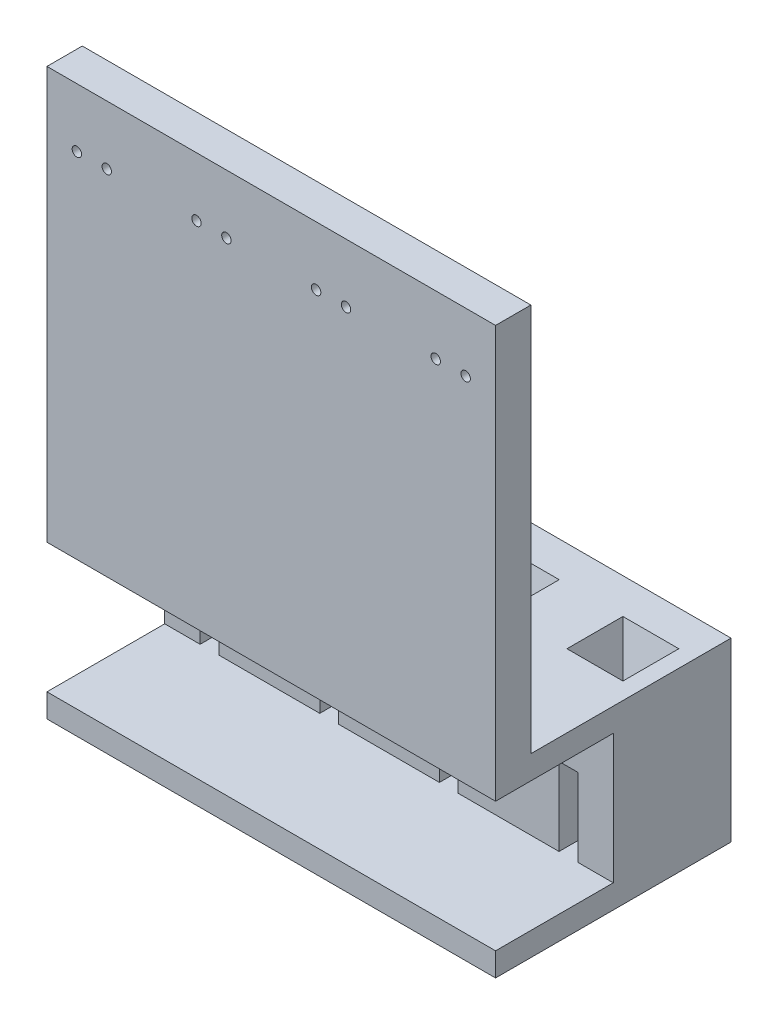
from build123d import *
from OCP.BRepFilletAPI import BRepFilletAPI_MakeChamfer

# Parameters (mm, degrees)
SKETCH_1_W          = 38.1
SKETCH_1_H          = 48
EXTRUDE_1_DEPTH     = 3
SKETCH_2_R          = 0.4
CUT_EXTRUDE_1_DEPTH = 31.78802527
SKETCH_3_W          = 38.1
SKETCH_3_H          = 15
EXTRUDE_2_DEPTH     = 17
SKETCH_4_W          = 2.75
SKETCH_4_H          = 2.75
CUT_EXTRUDE_2_DEPTH = 4
CHAMFER_1_SIZE      = 1
CHAMFER_1_SIZE_2    = 4
SKETCH_5_R          = 0.8
CUT_EXTRUDE_5_DEPTH = 55.36821222
SKETCH_6_W          = 38.1
SKETCH_6_H          = 11
CUT_EXTRUDE_6_DEPTH = 10
CUT_EXTRUDE_7_REACH = 34.232
SKETCH_8_W          = 1.6
SKETCH_8_H          = 6.622641265


with BuildPart() as part:
    # 草圖1 → 填料-伸長1 (new body)
    with BuildSketch(Plane.XY):
        Rectangle(SKETCH_1_W, SKETCH_1_H)
    extrude(amount=EXTRUDE_1_DEPTH)

    # 草圖2 → 除料-伸長1 (cut, through all)
    with BuildSketch(Plane.XY.offset(3)):
        with Locations((-16.51, 19)):
            Circle(SKETCH_2_R)
        with Locations((-13.97, 19)):
            Circle(SKETCH_2_R)
        with Locations((-6.35, 19)):
            Circle(SKETCH_2_R)
        with Locations((-3.81, 19)):
            Circle(SKETCH_2_R)
        with Locations((3.81, 19)):
            Circle(SKETCH_2_R)
        with Locations((6.35, 19)):
            Circle(SKETCH_2_R)
        with Locations((13.97, 19)):
            Circle(SKETCH_2_R)
        with Locations((16.51, 19)):
            Circle(SKETCH_2_R)
    extrude(amount=-CUT_EXTRUDE_1_DEPTH, mode=Mode.SUBTRACT)

    # 草圖3 → 填料-伸長2 (add)
    with BuildSketch(Plane(origin=(0, 0, 0), x_dir=(-1, 0, 0), z_dir=(0, 0, -1))):
        with Locations((0, -16.5)):
            Rectangle(SKETCH_3_W, SKETCH_3_H)
    extrude(amount=EXTRUDE_2_DEPTH)

    # 草圖4 → 除料-伸長2 (cut)
    with BuildSketch(Plane(origin=(0, -9, 0), x_dir=(1, 0, 0), z_dir=(0, 1, 0))):
        with Locations((-15.24, 11.625)):
            Rectangle(SKETCH_4_W, SKETCH_4_H)
        with Locations((-5.08, 11.625)):
            Rectangle(SKETCH_4_W, SKETCH_4_H)
        with Locations((5.08, 11.625)):
            Rectangle(SKETCH_4_W, SKETCH_4_H)
        with Locations((15.24, 11.625)):
            Rectangle(SKETCH_4_W, SKETCH_4_H)
    extrude(amount=-CUT_EXTRUDE_2_DEPTH, mode=Mode.SUBTRACT)

    # 導角1
    chamfer_1_edges_1 = [part.edges().sort_by_distance(p)[0] for p in [
        (-15.24, -9, -13),
    ]]
    chamfer_1_side_1 = [part.faces().sort_by_distance(p)[0] for p in [
        (-15.24, -9, -13.02),
    ]]
    chamfer_1_edges_2 = [part.edges().sort_by_distance(p)[0] for p in [
        (-13.865, -9, -11.625),
    ]]
    chamfer_1_side_2 = [part.faces().sort_by_distance(p)[0] for p in [
        (-13.845, -9, -11.625),
    ]]
    chamfer_1_edges_3 = [part.edges().sort_by_distance(p)[0] for p in [
        (-16.615, -9, -11.625),
    ]]
    chamfer_1_side_3 = [part.faces().sort_by_distance(p)[0] for p in [
        (-16.635, -9, -11.625),
    ]]
    chamfer_1_edges_4 = [part.edges().sort_by_distance(p)[0] for p in [
        (-15.24, -9, -10.25),
    ]]
    chamfer_1_side_4 = [part.faces().sort_by_distance(p)[0] for p in [
        (-15.24, -9, -10.23),
    ]]
    chamfer_1_edges_5 = [part.edges().sort_by_distance(p)[0] for p in [
        (15.24, -9, -10.25),
    ]]
    chamfer_1_side_5 = [part.faces().sort_by_distance(p)[0] for p in [
        (15.24, -9, -10.23),
    ]]
    chamfer_1_edges_6 = [part.edges().sort_by_distance(p)[0] for p in [
        (13.865, -9, -11.625),
    ]]
    chamfer_1_side_6 = [part.faces().sort_by_distance(p)[0] for p in [
        (13.845, -9, -11.625),
    ]]
    chamfer_1_edges_7 = [part.edges().sort_by_distance(p)[0] for p in [
        (16.615, -9, -11.625),
    ]]
    chamfer_1_side_7 = [part.faces().sort_by_distance(p)[0] for p in [
        (16.635, -9, -11.625),
    ]]
    chamfer_1_edges_8 = [part.edges().sort_by_distance(p)[0] for p in [
        (15.24, -9, -13),
    ]]
    chamfer_1_side_8 = [part.faces().sort_by_distance(p)[0] for p in [
        (15.24, -9, -13.02),
    ]]
    chamfer_1_edges_9 = [part.edges().sort_by_distance(p)[0] for p in [
        (5.08, -9, -10.25),
    ]]
    chamfer_1_side_9 = [part.faces().sort_by_distance(p)[0] for p in [
        (5.08, -9, -10.23),
    ]]
    chamfer_1_edges_10 = [part.edges().sort_by_distance(p)[0] for p in [
        (6.455, -9, -11.625),
    ]]
    chamfer_1_side_10 = [part.faces().sort_by_distance(p)[0] for p in [
        (6.475, -9, -11.625),
    ]]
    chamfer_1_edges_11 = [part.edges().sort_by_distance(p)[0] for p in [
        (5.08, -9, -13),
    ]]
    chamfer_1_side_11 = [part.faces().sort_by_distance(p)[0] for p in [
        (5.08, -9, -13.02),
    ]]
    chamfer_1_edges_12 = [part.edges().sort_by_distance(p)[0] for p in [
        (3.705, -9, -11.625),
    ]]
    chamfer_1_side_12 = [part.faces().sort_by_distance(p)[0] for p in [
        (3.685, -9, -11.625),
    ]]
    chamfer_1_edges_13 = [part.edges().sort_by_distance(p)[0] for p in [
        (-5.08, -9, -10.25),
    ]]
    chamfer_1_side_13 = [part.faces().sort_by_distance(p)[0] for p in [
        (-5.08, -9, -10.23),
    ]]
    chamfer_1_edges_14 = [part.edges().sort_by_distance(p)[0] for p in [
        (-6.455, -9, -11.625),
    ]]
    chamfer_1_side_14 = [part.faces().sort_by_distance(p)[0] for p in [
        (-6.475, -9, -11.625),
    ]]
    chamfer_1_edges_15 = [part.edges().sort_by_distance(p)[0] for p in [
        (-5.08, -9, -13),
    ]]
    chamfer_1_side_15 = [part.faces().sort_by_distance(p)[0] for p in [
        (-5.08, -9, -13.02),
    ]]
    chamfer_1_edges_16 = [part.edges().sort_by_distance(p)[0] for p in [
        (-3.705, -9, -11.625),
    ]]
    chamfer_1_side_16 = [part.faces().sort_by_distance(p)[0] for p in [
        (-3.685, -9, -11.625),
    ]]
    chamfer_1 = BRepFilletAPI_MakeChamfer(part.part.solid().wrapped)
    for e in chamfer_1_edges_1:
        chamfer_1.Add(CHAMFER_1_SIZE - 0.0001, CHAMFER_1_SIZE_2 - 0.0001, e.wrapped, chamfer_1_side_1[0].wrapped)
    for e in chamfer_1_edges_2:
        chamfer_1.Add(CHAMFER_1_SIZE - 0.0001, CHAMFER_1_SIZE_2 - 0.0001, e.wrapped, chamfer_1_side_2[0].wrapped)
    for e in chamfer_1_edges_3:
        chamfer_1.Add(CHAMFER_1_SIZE - 0.0001, CHAMFER_1_SIZE_2 - 0.0001, e.wrapped, chamfer_1_side_3[0].wrapped)
    for e in chamfer_1_edges_4:
        chamfer_1.Add(CHAMFER_1_SIZE - 0.0001, CHAMFER_1_SIZE_2 - 0.0001, e.wrapped, chamfer_1_side_4[0].wrapped)
    for e in chamfer_1_edges_5:
        chamfer_1.Add(CHAMFER_1_SIZE - 0.0001, CHAMFER_1_SIZE_2 - 0.0001, e.wrapped, chamfer_1_side_5[0].wrapped)
    for e in chamfer_1_edges_6:
        chamfer_1.Add(CHAMFER_1_SIZE - 0.0001, CHAMFER_1_SIZE_2 - 0.0001, e.wrapped, chamfer_1_side_6[0].wrapped)
    for e in chamfer_1_edges_7:
        chamfer_1.Add(CHAMFER_1_SIZE - 0.0001, CHAMFER_1_SIZE_2 - 0.0001, e.wrapped, chamfer_1_side_7[0].wrapped)
    for e in chamfer_1_edges_8:
        chamfer_1.Add(CHAMFER_1_SIZE - 0.0001, CHAMFER_1_SIZE_2 - 0.0001, e.wrapped, chamfer_1_side_8[0].wrapped)
    for e in chamfer_1_edges_9:
        chamfer_1.Add(CHAMFER_1_SIZE - 0.0001, CHAMFER_1_SIZE_2 - 0.0001, e.wrapped, chamfer_1_side_9[0].wrapped)
    for e in chamfer_1_edges_10:
        chamfer_1.Add(CHAMFER_1_SIZE - 0.0001, CHAMFER_1_SIZE_2 - 0.0001, e.wrapped, chamfer_1_side_10[0].wrapped)
    for e in chamfer_1_edges_11:
        chamfer_1.Add(CHAMFER_1_SIZE - 0.0001, CHAMFER_1_SIZE_2 - 0.0001, e.wrapped, chamfer_1_side_11[0].wrapped)
    for e in chamfer_1_edges_12:
        chamfer_1.Add(CHAMFER_1_SIZE - 0.0001, CHAMFER_1_SIZE_2 - 0.0001, e.wrapped, chamfer_1_side_12[0].wrapped)
    for e in chamfer_1_edges_13:
        chamfer_1.Add(CHAMFER_1_SIZE - 0.0001, CHAMFER_1_SIZE_2 - 0.0001, e.wrapped, chamfer_1_side_13[0].wrapped)
    for e in chamfer_1_edges_14:
        chamfer_1.Add(CHAMFER_1_SIZE - 0.0001, CHAMFER_1_SIZE_2 - 0.0001, e.wrapped, chamfer_1_side_14[0].wrapped)
    for e in chamfer_1_edges_15:
        chamfer_1.Add(CHAMFER_1_SIZE - 0.0001, CHAMFER_1_SIZE_2 - 0.0001, e.wrapped, chamfer_1_side_15[0].wrapped)
    for e in chamfer_1_edges_16:
        chamfer_1.Add(CHAMFER_1_SIZE - 0.0001, CHAMFER_1_SIZE_2 - 0.0001, e.wrapped, chamfer_1_side_16[0].wrapped)
    add(Compound.cast(chamfer_1.Shape()), mode=Mode.REPLACE)  # a hair under: the kernel refuses the full size

    # 草圖5 → 除料-伸長5 (cut, through all)
    with BuildSketch(Plane.XZ.offset(24)):
        with Locations(Location((-15.24, -11.625, 0), (0, 0, 270))):
            Circle(SKETCH_5_R)
        with Locations(Location((-5.08, -11.625, 0), (0, 0, 270))):
            Circle(SKETCH_5_R)
        with Locations(Location((5.08, -11.625, 0), (0, 0, 270))):
            Circle(SKETCH_5_R)
        with Locations(Location((15.24, -11.625, 0), (0, 0, 270))):
            Circle(SKETCH_5_R)
    extrude(amount=-CUT_EXTRUDE_5_DEPTH, mode=Mode.SUBTRACT)

    # 草圖6 → 除料-伸長6 (cut)
    with BuildSketch(Plane.XY.offset(3)):
        with Locations((0, -16.5)):
            Rectangle(SKETCH_6_W, SKETCH_6_H)
    extrude(amount=-CUT_EXTRUDE_6_DEPTH, mode=Mode.SUBTRACT)

    # 草圖8 → 除料-伸長7 (cut, up to next)
    with BuildSketch(Plane.XY.offset(-7), mode=Mode.PRIVATE) as cut_extrude_7_sk1:
        with Locations((-15.24, -18.688679368)):
            Rectangle(SKETCH_8_W, SKETCH_8_H)
    cut_extrude_7_tool1 = extrude(cut_extrude_7_sk1.sketch, amount=-CUT_EXTRUDE_7_REACH, mode=Mode.PRIVATE) & part.part
    # 草圖8 → 除料-伸長7 (cut, up to next)
    with BuildSketch(Plane.XY.offset(-7), mode=Mode.PRIVATE) as cut_extrude_7_sk2:
        with Locations((-5.08, -18.688679368)):
            Rectangle(SKETCH_8_W, SKETCH_8_H)
    cut_extrude_7_tool2 = extrude(cut_extrude_7_sk2.sketch, amount=-CUT_EXTRUDE_7_REACH, mode=Mode.PRIVATE) & part.part
    # 草圖8 → 除料-伸長7 (cut, up to next)
    with BuildSketch(Plane.XY.offset(-7), mode=Mode.PRIVATE) as cut_extrude_7_sk3:
        with Locations((5.08, -18.688679368)):
            Rectangle(SKETCH_8_W, SKETCH_8_H)
    cut_extrude_7_tool3 = extrude(cut_extrude_7_sk3.sketch, amount=-CUT_EXTRUDE_7_REACH, mode=Mode.PRIVATE) & part.part
    # 草圖8 → 除料-伸長7 (cut, up to next)
    with BuildSketch(Plane.XY.offset(-7), mode=Mode.PRIVATE) as cut_extrude_7_sk4:
        with Locations((15.24, -18.688679368)):
            Rectangle(SKETCH_8_W, SKETCH_8_H)
    cut_extrude_7_tool4 = extrude(cut_extrude_7_sk4.sketch, amount=-CUT_EXTRUDE_7_REACH, mode=Mode.PRIVATE) & part.part
    add(cut_extrude_7_tool1.solids().sort_by_distance((-15.24, -18.688679, -7))[0], mode=Mode.SUBTRACT)
    add(cut_extrude_7_tool2.solids().sort_by_distance((-5.08, -18.688679, -7))[0], mode=Mode.SUBTRACT)
    add(cut_extrude_7_tool3.solids().sort_by_distance((5.08, -18.688679, -7))[0], mode=Mode.SUBTRACT)
    add(cut_extrude_7_tool4.solids().sort_by_distance((15.24, -18.688679, -7))[0], mode=Mode.SUBTRACT)


solid = part.part
